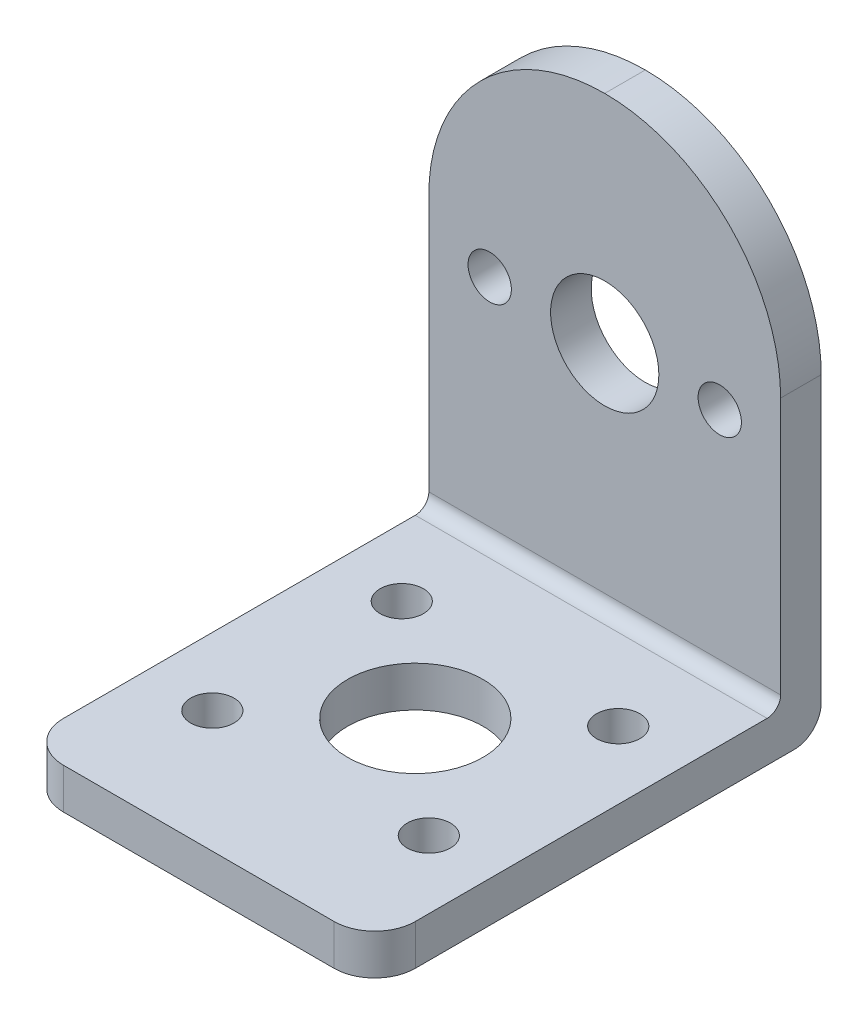
from build123d import *

# Parameters (mm, degrees)
SKETCH1_W           = 26
SKETCH1_H           = 33
SKETCH1_R           = 5
SKETCH1_R_2         = 1.6
BOSS_EXTRUDE1_DEPTH = 3
FILLET2_R           = 3
SKETCH2_W           = 26
SKETCH2_H           = 3
BOSS_EXTRUDE2_DEPTH = 33
FILLET3_R           = 13
SKETCH3_R           = 4
SKETCH3_R_2         = 1.6
CUT_EXTRUDE1_DEPTH  = 3
FILLET4_R           = 2
FILLET5_R           = 1


with BuildPart() as part:
    # Sketch1 → Boss-Extrude1 (new body)
    with BuildSketch(Plane(origin=(0, 0, 0), x_dir=(1, 0, 0), z_dir=(0, 1, 0))):
        Rectangle(SKETCH1_W, SKETCH1_H)
        with Locations(Location((0, -0.5, 0), (0, 0, 270))):
            Circle(SKETCH1_R, mode=Mode.SUBTRACT)
        with Locations(Location((8, 6.5, 0), (0, 0, 270))):
            Circle(SKETCH1_R_2, mode=Mode.SUBTRACT)
        with Locations(Location((-8, 6.5, 0), (0, 0, 90))):
            Circle(SKETCH1_R_2, mode=Mode.SUBTRACT)
        with Locations(Location((8, -7.5, 0), (0, 0, 90))):
            Circle(SKETCH1_R_2, mode=Mode.SUBTRACT)
        with Locations(Location((-8, -7.5, 0), (0, 0, 270))):
            Circle(SKETCH1_R_2, mode=Mode.SUBTRACT)
    extrude(amount=BOSS_EXTRUDE1_DEPTH)

    # Fillet2
    fillet2_edges = [part.edges().sort_by_distance(p)[0] for p in [
        (13, 1.5, 16.5),
        (-13, 1.5, 16.5),
    ]]
    fillet(fillet2_edges, radius=FILLET2_R)

    # Sketch2 → Boss-Extrude2 (add)
    with BuildSketch(Plane(origin=(0, 3, 0), x_dir=(1, 0, 0), z_dir=(0, 1, 0))):
        with Locations((0, 15)):
            Rectangle(SKETCH2_W, SKETCH2_H)
    extrude(amount=BOSS_EXTRUDE2_DEPTH)

    # Fillet3
    fillet3_edges = [part.edges().sort_by_distance(p)[0] for p in [
        (-13, 36, -15),
        (13, 36, -15),
    ]]
    fillet(fillet3_edges, radius=FILLET3_R - 0.0001)  # a hair under: the kernel refuses the full size

    # Sketch3 → Cut-Extrude1 (cut)
    with BuildSketch(Plane.XY.offset(-13.5)):
        with Locations((0, 20)):
            Circle(SKETCH3_R)
        with Locations((8.5, 20)):
            Circle(SKETCH3_R_2)
        with Locations(Location((-8.5, 20, 0), (0, 0, 180))):
            Circle(SKETCH3_R_2)
    extrude(amount=-CUT_EXTRUDE1_DEPTH, mode=Mode.SUBTRACT)

    # Fillet4
    fillet4_edges = [part.edges().sort_by_distance(p)[0] for p in [
        (0, 0, -16.5),
    ]]
    fillet(fillet4_edges, radius=FILLET4_R)

    # Fillet5
    fillet5_edges = [part.edges().sort_by_distance(p)[0] for p in [
        (0, 3, -13.5),
    ]]
    fillet(fillet5_edges, radius=FILLET5_R)


solid = part.part
